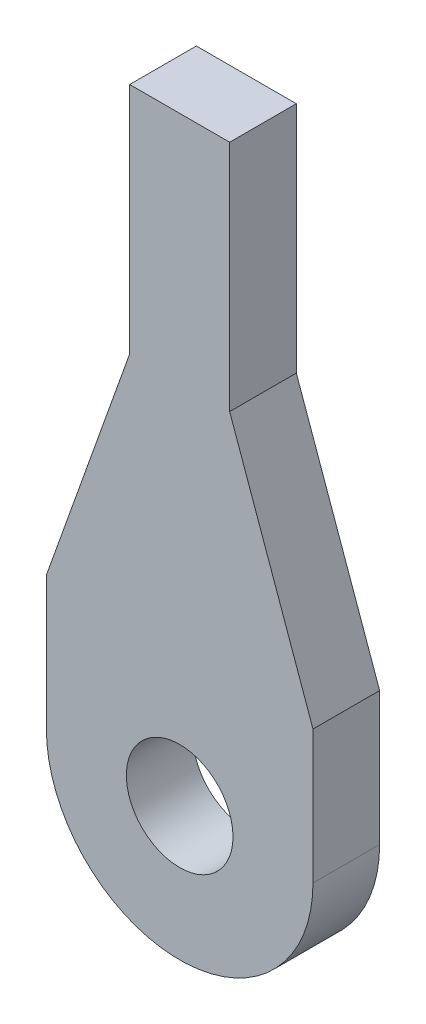
from build123d import *

# Parameters (mm, degrees)
SKETCH2_R           = 2.032
BOSS_EXTRUDE1_DEPTH = 2.54


with BuildPart() as part:
    # Sketch2 → Boss-Extrude1 (new body)
    with BuildSketch(Plane(origin=(0, 0, 0), x_dir=(0, 1, 0), z_dir=(0, 0, 1))):
        with BuildLine():
            Line((0, 5.08), (5.08, 5.08))
            Line((5.08, 5.08), (13.97, 1.905))
            Line((13.97, 1.905), (22.86, 1.905))
            Line((22.86, 1.905), (22.86, -1.905))
            Line((22.86, -1.905), (13.97, -1.905))
            Line((13.97, -1.905), (5.08, -5.08))
            Line((5.08, -5.08), (0, -5.08))
            ThreePointArc((0, -5.08), (-5.08, 0), (0, 5.08))
        make_face()
        Circle(SKETCH2_R, mode=Mode.SUBTRACT)
    extrude(amount=BOSS_EXTRUDE1_DEPTH)


solid = part.part
